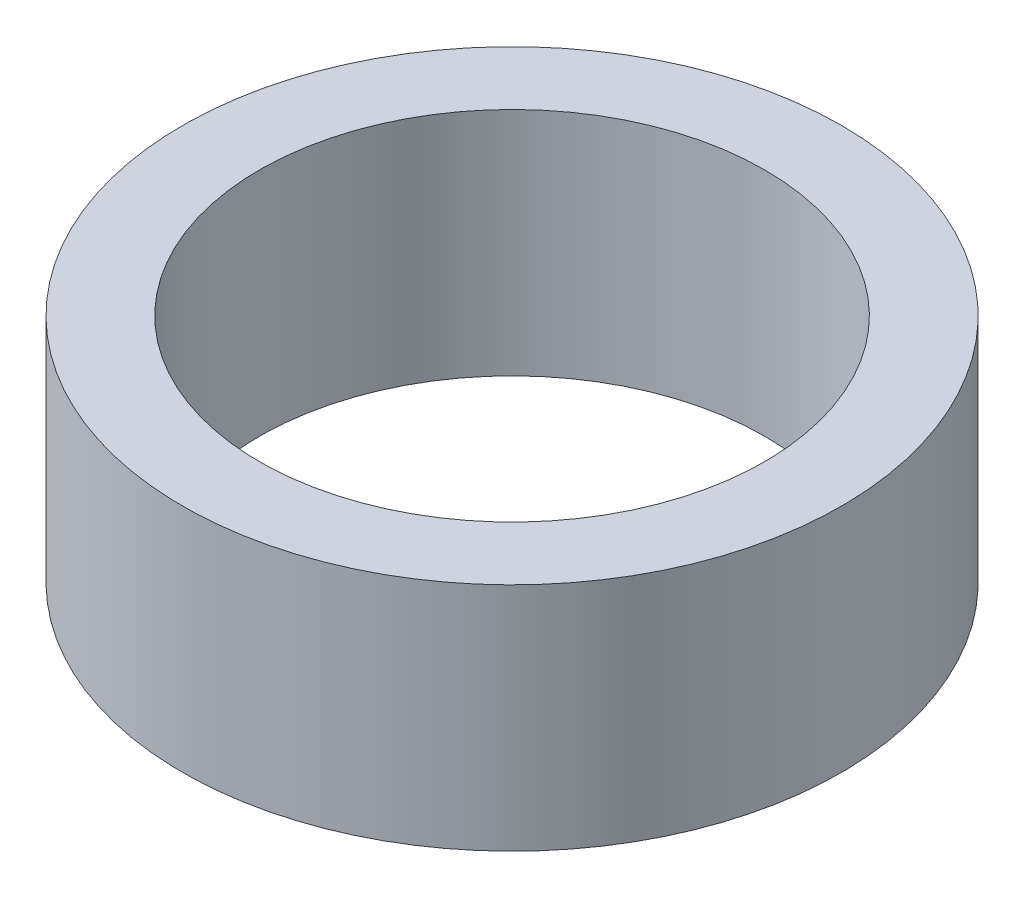
from build123d import *

# Parameters (mm, degrees)
SKETCH_1_R      = 30
SKETCH_1_R_2    = 23
EXTRUDE_1_DEPTH = 21


with BuildPart() as part:
    # 草图1 → 凸台-拉伸1 (new body)
    with BuildSketch(Plane(origin=(0, 0, 0), x_dir=(1, 0, 0), z_dir=(0, 1, 0))):
        Circle(SKETCH_1_R)
        Circle(SKETCH_1_R_2, mode=Mode.SUBTRACT)
    extrude(amount=EXTRUDE_1_DEPTH)


solid = part.part
